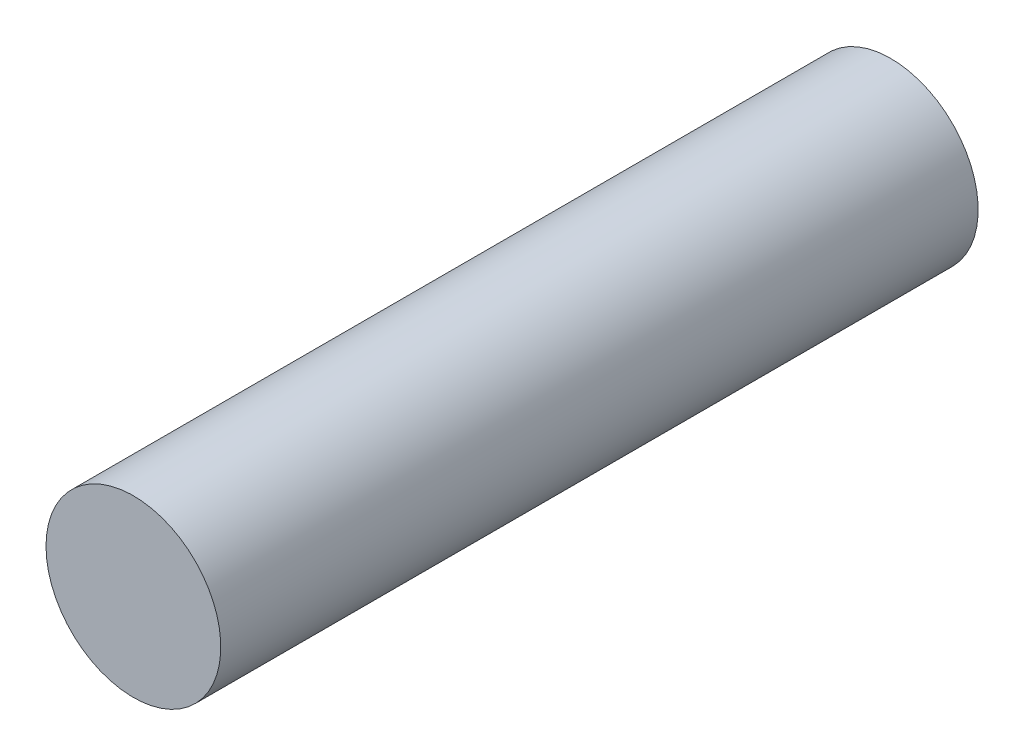
from build123d import *

# Parameters (mm, degrees)
SKETCH1_R           = 1.5
BOSS_EXTRUDE1_DEPTH = 6.5


with BuildPart() as part:
    # Sketch1 → Boss-Extrude1 (new, symmetric)
    with BuildSketch(Plane.XY):
        Circle(SKETCH1_R)
    extrude(amount=BOSS_EXTRUDE1_DEPTH, both=True)


solid = part.part
